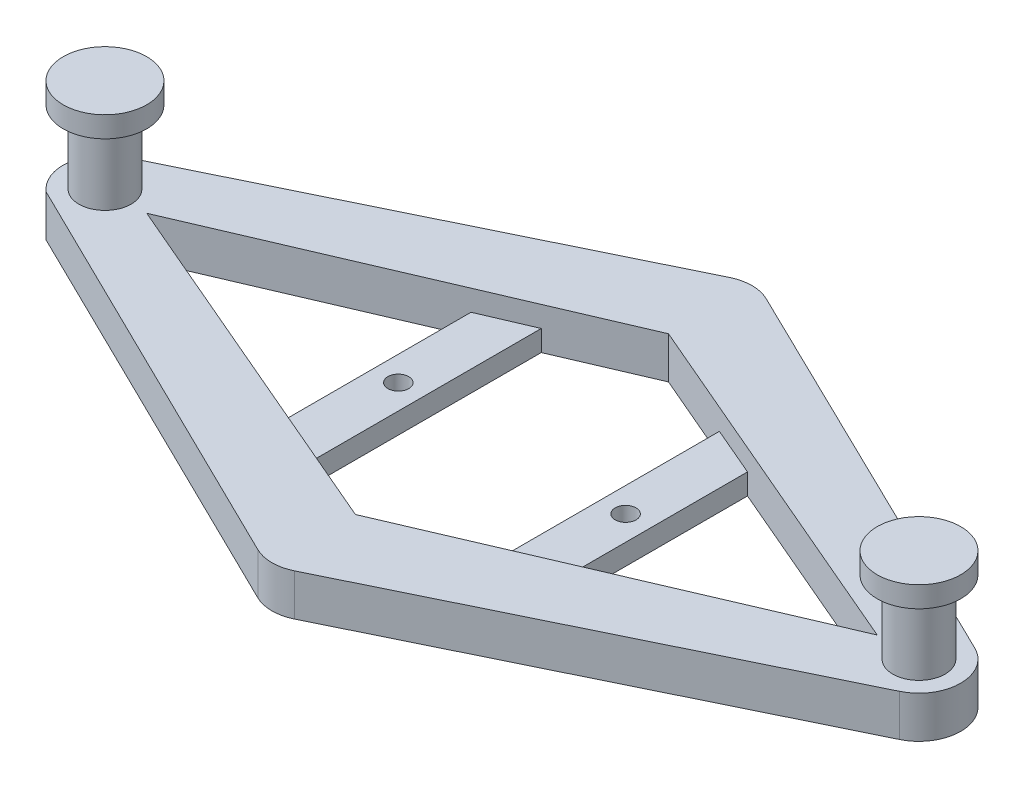
from build123d import *

# Parameters (mm, degrees)
BOSS_EXTRUDE1_DEPTH   = 5.08
SKETCH5_R             = 3.175
BOSS_EXTRUDE2_DEPTH   = 8.89
SKETCH12_R            = 5.08
BOSS_EXTRUDE4_DEPTH   = 2.54
SKETCH14_R            = 5.08
BOSS_EXTRUDE5_DEPTH   = 2.54
SKETCH15_R            = 1.27
BOSS_EXTRUDE6_DEPTH   = 2.54
BOSS_EXTRUDE6_2_DEPTH = 2.54


with BuildPart() as part:
    # Sketch4 → Boss-Extrude1 (new body)
    with BuildSketch(Plane(origin=(0, 0, 0), x_dir=(1, 0, 0), z_dir=(0, 1, 0))):
        with BuildLine():
            Line((-51.75488467, 4.566868534), (-2.22488467, 28.696868534))
            ThreePointArc((-2.22488467, 28.696868534), (1.2433e-05, 29.21), (2.224907024, 28.696857643))
            Line((2.224907024, 28.696857643), (51.70773276, 4.589540285))
            ThreePointArc((51.70773276, 4.589540285), (54.609932644, 0.026159658), (51.75488467, -4.566868534))
            Line((51.75488467, -4.566868534), (2.22488467, -28.696868534))
            ThreePointArc((2.22488467, -28.696868534), (-0.00727814, -29.209994786), (-2.237961471, -28.690474587))
            Line((-2.237961471, -28.690474587), (-52.826499461, -3.865163813))
            ThreePointArc((-52.826499461, -3.865163813), (-54.569465553, 0.640458386), (-51.75488467, 4.566868534))
        make_face()
        Polygon((-44.45, 0), (0, 19.05), (44.45, 0), (0, -19.05), align=None, mode=Mode.SUBTRACT)
    extrude(amount=BOSS_EXTRUDE1_DEPTH)

    # Sketch5 → Boss-Extrude2 (add)
    with BuildSketch(Plane(origin=(0, 5.08, 0), x_dir=(1, 0, 0), z_dir=(0, 1, 0))):
        with Locations((-49.53, 0)):
            Circle(SKETCH5_R)
        with Locations((49.53, 0)):
            Circle(SKETCH5_R)
    extrude(amount=BOSS_EXTRUDE2_DEPTH)

    # Sketch12 → Boss-Extrude4 (add)
    with BuildSketch(Plane(origin=(0, 13.97, 0), x_dir=(1, 0, 0), z_dir=(0, 1, 0))):
        with Locations((49.53, 0)):
            Circle(SKETCH12_R)
    extrude(amount=BOSS_EXTRUDE4_DEPTH)

    # Sketch14 → Boss-Extrude5 (add)
    with BuildSketch(Plane(origin=(0, 13.97, 0), x_dir=(1, 0, 0), z_dir=(0, 1, 0))):
        with Locations((-49.53, 0)):
            Circle(SKETCH14_R)
    extrude(amount=BOSS_EXTRUDE5_DEPTH)


with BuildPart() as body_2:
    # Sketch15 → Boss-Extrude6 (new body)
    with BuildSketch(Plane(origin=(0, 0, 0), x_dir=(1, 0, 0), z_dir=(0, 1, 0))):
        Polygon((-10.839034868, 14.404699342), (-10.839034868, -14.404699342), (-16.823699484, -11.839843078), (-16.823699484, 11.839843078), align=None)
        with Locations((-13.831367176, 0)):
            Circle(SKETCH15_R, mode=Mode.SUBTRACT)
    extrude(amount=BOSS_EXTRUDE6_DEPTH)


with BuildPart() as body_3:
    # Sketch15 → Boss-Extrude6 2 (new body)
    with BuildSketch(Plane(origin=(0, 0, 0), x_dir=(1, 0, 0), z_dir=(0, 1, 0))):
        Polygon((16.823699484, 11.839843078), (10.839034868, 14.404699342), (10.839034868, -14.404699342), (16.823699484, -11.839843078), align=None)
        with Locations((13.831367176, 0)):
            Circle(SKETCH15_R, mode=Mode.SUBTRACT)
    extrude(amount=BOSS_EXTRUDE6_2_DEPTH)


solid = Compound([part.part, body_2.part, body_3.part])
